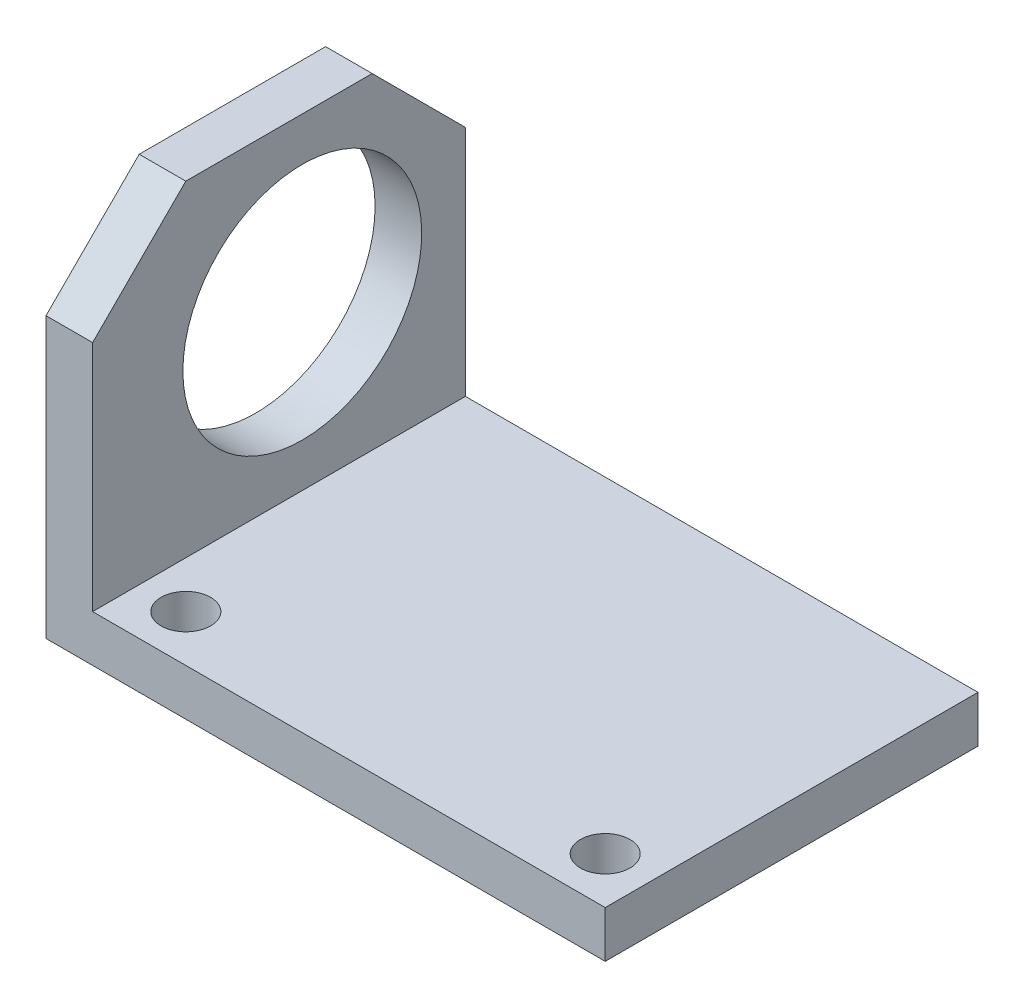
from build123d import *

# Parameters (mm, degrees)
BOSS_EXTRUDE1_DEPTH       = 25.4
F_1_4_CLEARANCE_HOLE1_D   = 6.7564
F_1_1_4_CLEARANCE_HOLE1_D = 32.54248
CHAMFER1_SIZE             = 12.7


with BuildPart() as part:
    # Sketch1 → Boss-Extrude1 (new, symmetric)
    with BuildSketch(Plane.XY):
        Polygon((0, 0), (76.2, 0), (76.2, 6.35), (6.35, 6.35), (6.35, 50.8), (0, 50.8), align=None)
    extrude(amount=BOSS_EXTRUDE1_DEPTH, both=True)

    # 1/4 Clearance Hole1 (through all)
    with Locations(Plane(origin=(0, 0, 0), x_dir=(-1, 0, 0), z_dir=(0, -1, 0))):
        with Locations((-12.7, -19.05), (-69.85, -19.05)):
            Hole(F_1_4_CLEARANCE_HOLE1_D / 2)

    # 1-1/4 Clearance Hole1 (through all)
    with Locations(Plane.ZY):
        with Locations((-3.175, 28.575)):
            Hole(F_1_1_4_CLEARANCE_HOLE1_D / 2)

    # Chamfer1
    chamfer1_edges = [part.edges().sort_by_distance(p)[0] for p in [
        (3.175, 50.8, -25.4),
        (3.175, 50.8, 25.4),
    ]]
    chamfer(chamfer1_edges, length=CHAMFER1_SIZE)


solid = part.part
